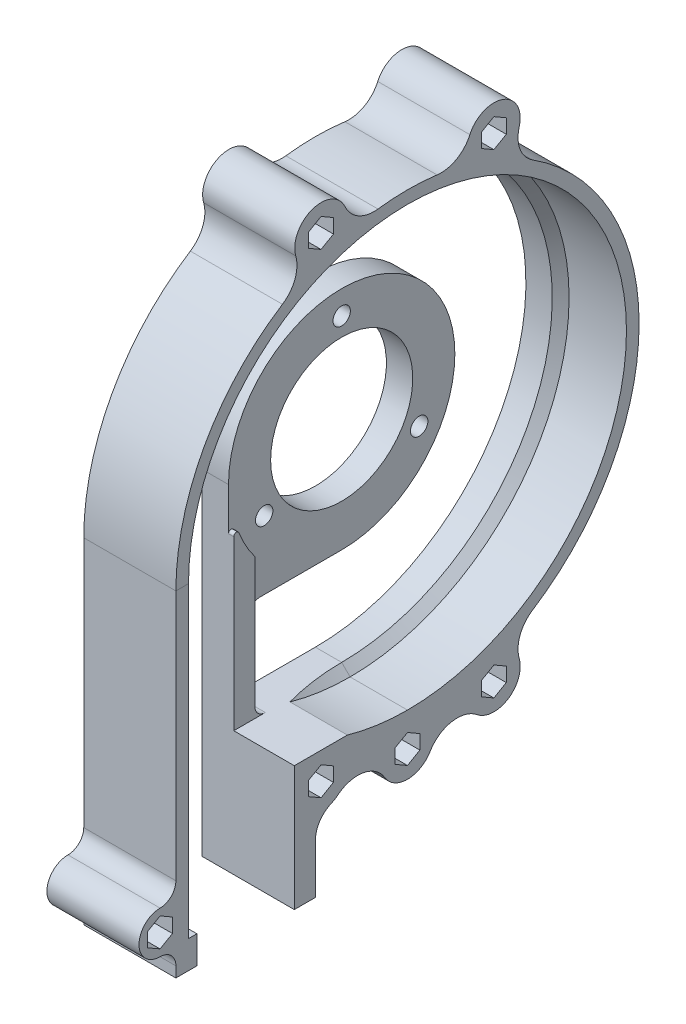
from build123d import *

# Parameters (mm, degrees)
SKETCH_2_W           = 17.5
SKETCH_2_H           = 4
EXTRUDE_1_DEPTH      = 6
SKETCH_6_R           = 13.5
SKETCH_6_R_2         = 1.65
EXTRUDE_2_DEPTH      = 5
FILLET_1_R           = 2
EXTRUDE_START        = -17.5
SKETCH_7_R           = 5
EXTRUDE_3_DEPTH      = 17.5
FILLET_2_R           = 6
CUT_EXTRUDE_1_DEPTH  = 72.072146443
SKETCH_9_W           = 17.5
SKETCH_9_H           = 4
EXTRUDE_4_DEPTH      = 11.4
FILLET_3_R           = 5
EXTRUDE_5_DEPTH      = 0.28
EXTRUDE_5_DEPTH_BACK = 5
SKETCH_10_W          = 17.5
SKETCH_10_H          = 4
SKETCH_11_R          = 4
EXTRUDE_6_DEPTH      = 17.5
FILLET_4_R           = 3


with BuildPart() as part:
    # Sweep 1: sweep along a path in 草图1
    with BuildLine(Plane(origin=(0, 0, 0), x_dir=(0, 0, -1), z_dir=(1, 0, 0))) as sweep_1_path:
        Line((-44, -52), (-44, 0))
        ThreePointArc((-44, 0), (31.112698372, 31.112698372), (0, -44))
        Line((0, -44), (-17.5, -44))
        Line((-17.5, -44), (-17.5, -52))
    # 草图2 → Sweep 1 (sweep)
    with BuildSketch(Plane(origin=(0, -52, 0), x_dir=(1, 0, 0), z_dir=(0, 1, 0))):
        with Locations((8.75, -42)):
            Rectangle(SKETCH_2_W, SKETCH_2_H)
    sweep(path=sweep_1_path.line, transition=Transition.RIGHT)

    # Sweep 1 2: sweep along a path in 草图4
    with BuildLine(Plane.ZY) as sweep_1_2_path:
        Line((44, -52), (44, 0))
        ThreePointArc((44, 0), (-31.112698372, 31.112698372), (0, -44))
        ThreePointArc((0, -44), (12.692125838, -42.129680057), (24.3052364, -36.677724623))
    # 草图3 → Sweep 1 2 (sweep, cut)
    with BuildSketch(Plane(origin=(0, -52, 0), x_dir=(1, 0, 0), z_dir=(0, 1, 0))):
        Polygon((17.5, -40), (5, -40), (6.6, -41.6), (17.5, -41.6), align=None)
    sweep(path=sweep_1_2_path.line, mode=Mode.SUBTRACT)

    # 草图5 → 凸台-拉伸1 (add)
    with BuildSketch(Plane.ZY):
        with BuildLine():
            Line((21.5, -40), (21.5, -8.077747211))
            ThreePointArc((21.5, -8.077747211), (21.091287093, -7.586151171), (20.533333333, -7.898241717))
            ThreePointArc((20.533333333, -7.898241717), (19.209784895, -10.723066925), (17.5, -13.332291626))
            Line((17.5, -13.332291626), (17.5, -40))
            Line((17.5, -40), (21.5, -40))
        make_face()
    extrude(amount=-EXTRUDE_1_DEPTH)

    # 草图6 → 凸台-拉伸2 (add)
    with BuildSketch(Plane.ZY):
        with BuildLine():
            Line((21.5, -21.5), (21.5, -8.077747211))
            Line((21.5, -8.077747211), (21.5, 0))
            ThreePointArc((21.5, 0), (-15.202795796, 15.202795796), (0, -21.5))
            Line((0, -21.5), (21.5, -21.5))
        make_face()
        Circle(SKETCH_6_R, mode=Mode.SUBTRACT)
        with Locations((0, 17)):
            Circle(SKETCH_6_R_2, mode=Mode.SUBTRACT)
        with Locations((14.722431864, -8.5)):
            Circle(SKETCH_6_R_2, mode=Mode.SUBTRACT)
        with Locations((-14.722431864, -8.5)):
            Circle(SKETCH_6_R_2, mode=Mode.SUBTRACT)
    extrude(amount=-EXTRUDE_2_DEPTH)

    # 圆角1
    fillet_1_edges = [part.edges().sort_by_distance(p)[0] for p in [
        (3, -40, 17.5),
        (2.5, -21.5, 17.5),
    ]]
    fillet(fillet_1_edges, radius=FILLET_1_R)

    # 草图7 → 凸台-拉伸3 (add)
    # profile 1 of 7: a face of its own
    with BuildSketch(Plane.ZY.offset(EXTRUDE_START)):
        with BuildLine():
            ThreePointArc((-11.41696688, -45.105245798), (-11.647855738, -43.60338731), (-12.319198447, -42.240233778))
            ThreePointArc((-12.319198447, -42.240233778), (-15.048886306, -41.346475315), (-17.714445389, -40.276524485))
            ThreePointArc((-17.714445389, -40.276524485), (-20.865936265, -47.387058983), (-13.252416867, -48.976372665))
            ThreePointArc((-13.252416867, -48.976372665), (-11.899071902, -47.247353398), (-11.41696688, -45.105245798))
        make_face()
        Polygon((-14.06696688, -46.46201893), (-16.41696688, -47.818792063), (-18.76696688, -46.46201893), (-18.76696688, -43.748472665), (-16.41696688, -42.391699533), (-14.06696688, -43.748472665), align=None, mode=Mode.SUBTRACT)
    # profile 2 of 7: a face of its own
    with BuildSketch(Plane.ZY.offset(EXTRUDE_START)):
        with BuildLine():
            ThreePointArc((-4.29770766, -50.555329502), (-4.888687372, -46.950840441), (-2.870750936, -43.90625))
            ThreePointArc((-2.870750936, -43.90625), (-7.640519817, -43.331541133), (-12.319198447, -42.240233778))
            ThreePointArc((-12.319198447, -42.240233778), (-11.647855738, -43.60338731), (-11.41696688, -45.105245798))
            ThreePointArc((-11.41696688, -45.105245798), (-11.899071902, -47.247353398), (-13.252416867, -48.976372665))
            ThreePointArc((-13.252416867, -48.976372665), (-8.413067787, -47.712878387), (-4.29770766, -50.555329502))
        make_face()
    # profile 3 of 7: a face of its own
    with BuildSketch(Plane.ZY.offset(EXTRUDE_START)):
        with BuildLine():
            ThreePointArc((5, -48), (4.472135955, -45.763932023), (3, -44))
            ThreePointArc((3, -44), (1.58113883, -43.25658351), (0, -43))
            Line((0, -43), (0, -44))
            ThreePointArc((0, -44), (-1.436140662, -43.976556254), (-2.870750936, -43.90625))
            ThreePointArc((-2.870750936, -43.90625), (-4.888687372, -46.950840441), (-4.29770766, -50.555329502))
            ThreePointArc((-4.29770766, -50.555329502), (0, -53), (4.29770766, -50.555329502))
            ThreePointArc((4.29770766, -50.555329502), (4.821231083, -49.325039942), (5, -48))
        make_face()
        Polygon((-2.35, -46.643226867), (0, -45.286453735), (2.35, -46.643226867), (2.35, -49.356773133), (0, -50.713546265), (-2.35, -49.356773133), align=None, mode=Mode.SUBTRACT)
    # profile 4 of 7: a face of its own
    with BuildSketch(Plane.ZY.offset(EXTRUDE_START)):
        with BuildLine():
            Line((11.540653546, -44), (3, -44))
            ThreePointArc((3, -44), (4.472135955, -45.763932023), (5, -48))
            ThreePointArc((5, -48), (4.821231083, -49.325039942), (4.29770766, -50.555329502))
            ThreePointArc((4.29770766, -50.555329502), (8.413067787, -47.712878387), (13.252416867, -48.976372665))
            ThreePointArc((13.252416867, -48.976372665), (11.688865563, -46.731609207), (11.540653546, -44))
        make_face()
    # profile 5 of 7: a face of its own
    with BuildSketch(Plane.ZY.offset(EXTRUDE_START)):
        with Locations((16.41696688, -45.105245798)):
            Circle(SKETCH_7_R)
        Polygon((18.76696688, -46.46201893), (16.41696688, -47.818792063), (14.06696688, -46.46201893), (14.06696688, -43.748472665), (16.41696688, -42.391699533), (18.76696688, -43.748472665), align=None, mode=Mode.SUBTRACT)
    # profile 6 of 7: a face of its own
    with BuildSketch(Plane.ZY.offset(EXTRUDE_START)):
        with BuildLine():
            ThreePointArc((-11.41696688, 45.105245798), (-19.459384295, 49.07307849), (-17.714445389, 40.276524485))
            ThreePointArc((-17.714445389, 40.276524485), (-15.048886306, 41.346475315), (-12.319198447, 42.240233778))
            ThreePointArc((-12.319198447, 42.240233778), (-11.647855738, 43.60338731), (-11.41696688, 45.105245798))
        make_face()
        Polygon((-18.76696688, 43.748472665), (-18.76696688, 46.46201893), (-16.41696688, 47.818792063), (-14.06696688, 46.46201893), (-14.06696688, 43.748472665), (-16.41696688, 42.391699533), align=None, mode=Mode.SUBTRACT)
    # profile 7 of 7: a face of its own
    with BuildSketch(Plane.ZY.offset(EXTRUDE_START)):
        with BuildLine():
            ThreePointArc((21.41696688, 45.105245798), (14.915108391, 49.874356939), (12.319198447, 42.240233778))
            ThreePointArc((12.319198447, 42.240233778), (15.048886306, 41.346475315), (17.714445389, 40.276524485))
            ThreePointArc((17.714445389, 40.276524485), (20.384799572, 42.062828383), (21.41696688, 45.105245798))
        make_face()
        Polygon((14.06696688, 46.46201893), (16.41696688, 47.818792063), (18.76696688, 46.46201893), (18.76696688, 43.748472665), (16.41696688, 42.391699533), (14.06696688, 43.748472665), align=None, mode=Mode.SUBTRACT)
    extrude(amount=EXTRUDE_3_DEPTH)

    # 圆角2
    # the kernel refuses this fillet: 6 mm, written as the material it adds along each edge
    with BuildSketch(Plane(origin=(17.5, 40.276524485, -17.714445389), x_dir=(0, -0.4726837072692949, -0.8812321560645388), z_dir=(-1, 0, 0)), Plane(origin=(17.5, 42.240233778, 12.319198447), x_dir=(0, 0.20434838386912327, -0.978898226584397), z_dir=(-1, 0, 0))) as fillet_2_piece_1:
        with BuildLine():
            CenterArc((7.322424831, -5.98176794), FILLET_2_R, 94.467760731, 73.250864603)
            Line((1.459736191, -4.705491359), (1.342482418, -4.679965828))
            ThreePointArc((1.342482418, -4.679965828), (1.235040355, -2.196031285), (-0.082220104, -0.087406261))
            Line((-0.082220104, -0.087406261), (0.009347776, 0.119635359))
            ThreePointArc((0.009347776, 0.119635359), (3.427518006, -0.013701771), (6.845688236, 0.119635359))
            Line((6.845688236, 0.119635359), (6.855036012, 0))
        make_face()
    extrude(amount=17.5)
    with BuildSketch(Plane(origin=(17.5, 42.240233778, -12.319198447), x_dir=(0, 0.20434838386906956, 0.9788982265844082), z_dir=(-1, 0, 0)), Plane(origin=(17.5, 40.276524485, 17.714445389), x_dir=(0, -0.47268370726929204, 0.8812321560645403), z_dir=(-1, 0, 0)), Plane(origin=(17.5, -40.276524485, -17.714445389), x_dir=(0, 0.47268370726929143, -0.8812321560645405), z_dir=(-1, 0, 0))) as fillet_2_piece_2:
        with BuildLine():
            CenterArc((7.322424831, 5.98176794), FILLET_2_R, 192.281374666, 73.250864603)
            Line((1.459736191, 4.705491359), (1.342482418, 4.679965828))
            ThreePointArc((1.342482418, 4.679965828), (1.235040355, 2.196031285), (-0.082220104, 0.087406261))
            Line((-0.082220104, 0.087406261), (0.009347776, -0.119635359))
            ThreePointArc((0.009347776, -0.119635359), (3.427518006, 0.013701771), (6.845688236, -0.119635359))
            Line((6.845688236, -0.119635359), (6.855036012, 0))
        make_face()
    extrude(amount=17.5)
    with BuildSketch(Plane(origin=(0, -49.986540632, 17.5), x_dir=(0, -1, 0), z_dir=(1, 0, 0))) as fillet_2_piece_3:
        with BuildLine():
            CenterArc((5.420881339, 4.938570189), FILLET_2_R, 200.518106547, 34.877722735)
            Line((-0.198487483, 2.83554997), (-0.310874859, 2.793489565))
            ThreePointArc((-0.310874859, 2.793489565), (-0.013206953, 1.423797529), (-0.117151076, 0.025992795))
            Line((-0.117151076, 0.025992795), (0, -0.12))
            ThreePointArc((0, -0.12), (1.006729684, -0.12), (1.945310928, -0.098771404))
            Line((1.945310928, -0.098771404), (2.013459368, 0))
        make_face()
    extrude(amount=17.5)

    # 草图8 → 切除-拉伸1 (cut, through all)
    with BuildSketch(Plane(origin=(17.5, 0, 0), x_dir=(0, 0, -1), z_dir=(1, 0, 0))):
        Polygon((-14.06696688, -46.46201893), (-14.06696688, -43.748472665), (-16.41696688, -42.391699533), (-18.76696688, -43.748472665), (-18.76696688, -46.46201893), (-16.41696688, -47.818792063), align=None)
    extrude(amount=-CUT_EXTRUDE_1_DEPTH, mode=Mode.SUBTRACT)

    # 草图9 → 凸台-拉伸4 (add)
    with BuildSketch(Plane.XZ.offset(52)):
        with Locations((8.75, 19.5)):
            Rectangle(SKETCH_9_W, SKETCH_9_H)
        Polygon((6.6, 41.6), (17.5, 41.6), (17.5, 44), (0, 44), (0, 40), (5, 40), align=None)
    extrude(amount=EXTRUDE_4_DEPTH)

    # 圆角3
    fillet_3_edges = [part.edges().sort_by_distance(p)[0] for p in [
        (8.75, -52, 17.5),
    ]]
    fillet(fillet_3_edges, radius=FILLET_3_R)

    # 草图10 → 凸台-拉伸5 (add, two sides: drawn at the far end of the back side and taken through both)
    with BuildSketch(Plane.XZ.offset(63.4).offset(-EXTRUDE_5_DEPTH_BACK)):
        with Locations((8.75, 42)):
            Rectangle(SKETCH_10_W, SKETCH_10_H)
        with Locations((8.75, 19.5)):
            Rectangle(SKETCH_10_W, SKETCH_10_H)
    extrude(amount=EXTRUDE_5_DEPTH + EXTRUDE_5_DEPTH_BACK)

    # 草图11 → 凸台-拉伸6 (add)
    with BuildSketch(Plane(origin=(17.5, 0, 0), x_dir=(0, 0, -1), z_dir=(1, 0, 0))):
        with Locations((-47, -54.68)):
            Circle(SKETCH_11_R)
        Polygon((-44.65, -53.323226867), (-47, -51.966453735), (-49.35, -53.323226867), (-49.35, -56.036773133), (-47, -57.393546265), (-44.65, -56.036773133), align=None, mode=Mode.SUBTRACT)
    extrude(amount=-EXTRUDE_6_DEPTH)

    # 圆角4
    fillet_4_edges = [part.edges().sort_by_distance(p)[0] for p in [
        (8.75, -52.034248689, 44),
        (8.75, -57.325751311, 44),
    ]]
    fillet(fillet_4_edges, radius=FILLET_4_R)


solid = part.part
